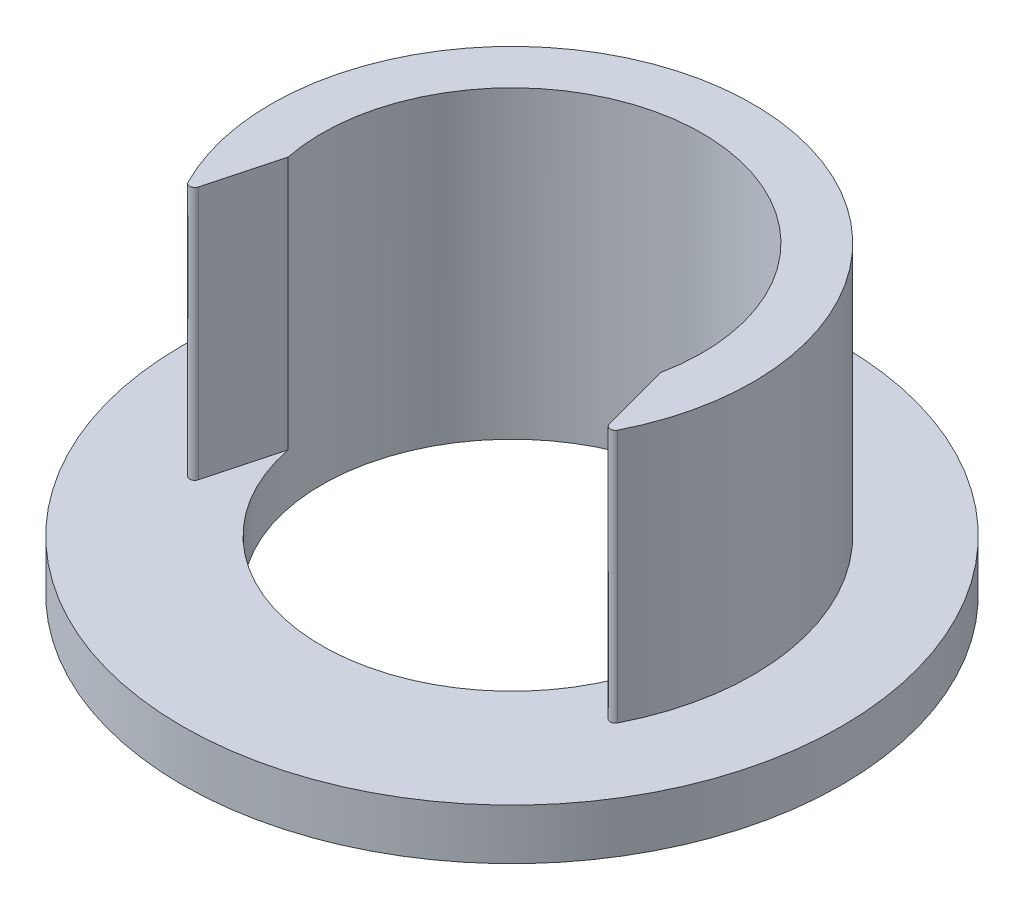
from build123d import *

# Parameters (mm, degrees)
SKETCH_2_R      = 65
SKETCH_2_R_2    = 37.5
EXTRUDE_1_DEPTH = 10
EXTRUDE_2_DEPTH = 50
CHAMFER_1_SIZE  = 10
FILLET_2_R      = 1


with BuildPart() as part:
    # 草圖2 → 填料-伸長1 (new body)
    with BuildSketch(Plane(origin=(0, 0, 0), x_dir=(1, 0, 0), z_dir=(0, 1, 0))):
        with Locations(Location((0, 0, 0), (0, 0, 270))):
            Circle(SKETCH_2_R)
        with Locations(Location((0, 0, 0), (0, 0, 270))):
            Circle(SKETCH_2_R_2, mode=Mode.SUBTRACT)
    extrude(amount=EXTRUDE_1_DEPTH)

    # 草圖3 → 填料-伸長2 (add)
    with BuildSketch(Plane(origin=(0, 10, 0), x_dir=(1, 0, 0), z_dir=(0, 1, 0))):
        with BuildLine():
            Line((-32.475952642, -18.75), (-41.13620668, -23.75))
            ThreePointArc((-41.13620668, -23.75), (0, 47.5), (41.13620668, -23.75))
            Line((41.13620668, -23.75), (32.475952642, -18.75))
            ThreePointArc((32.475952642, -18.75), (0, 37.5), (-32.475952642, -18.75))
        make_face()
    extrude(amount=EXTRUDE_2_DEPTH)

    # 導角1
    # the kernel refuses this chamfer: 10 mm, written as the material it takes off along each edge
    with BuildSketch(Plane(origin=(32.475952642, 10, 18.75), x_dir=(0.35352025121745984, 0, -0.935426871529327), z_dir=(0, 1, 0))) as chamfer_1_piece_1:
        with BuildLine():
            Line((12.116693809, 0), (-CHAMFER_1_SIZE * 0.161555917458, -CHAMFER_1_SIZE * 0.986863559736))
            Line((-CHAMFER_1_SIZE * 0.161555917458, -CHAMFER_1_SIZE * 0.986863559736), (0, 0))
            ThreePointArc((0, 0), (6.22343893, -0.492253103), (12.116693809, 0))
        make_face()
    extrude(amount=81.109263918, mode=Mode.SUBTRACT)
    with BuildSketch(Plane(origin=(-32.475952642, 10, 18.75), x_dir=(-0.3535202512174606, 0, -0.9354268715293267), z_dir=(0, 1, 0))) as chamfer_1_piece_2:
        with BuildLine():
            Line((12.116693809, 0), (-CHAMFER_1_SIZE * 0.161555917458, CHAMFER_1_SIZE * 0.986863559736))
            Line((-CHAMFER_1_SIZE * 0.161555917458, CHAMFER_1_SIZE * 0.986863559736), (0, 0))
            ThreePointArc((0, 0), (6.22343893, 0.492253103), (12.116693809, 0))
        make_face()
    extrude(amount=81.109263918, mode=Mode.SUBTRACT)

    # 圓角2
    fillet_2_edges = [part.edges().sort_by_distance(p)[0] for p in [
        (41.13620668, 35, 23.75),
        (-41.13620668, 35, 23.75),
    ]]
    fillet(fillet_2_edges, radius=FILLET_2_R)


solid = part.part
